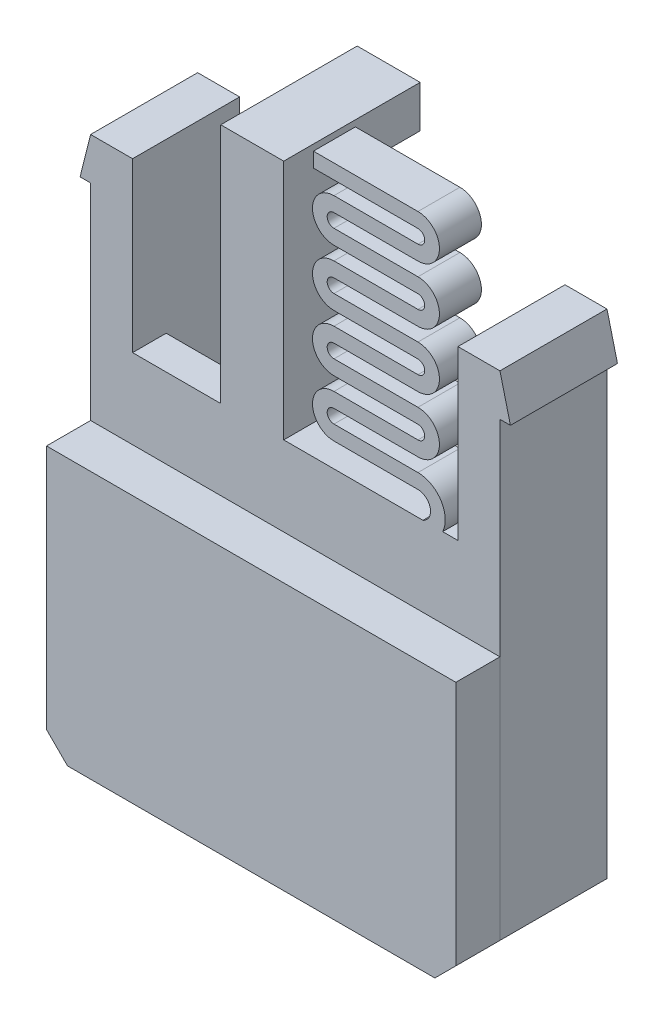
from build123d import *

# Parameters (mm, degrees)
SKETCH_1_W           = 19.5
SKETCH_1_H           = 12.7
EXTRUDE_1_DEPTH      = 2.1
SKETCH_2_W           = 19.5
SKETCH_2_H           = 24.5
EXTRUDE_2_DEPTH      = 5.1
SKETCH_3_W           = 15.5
SKETCH_3_H           = 3.5
CUT_EXTRUDE_1_DEPTH  = 23
CUT_EXTRUDE_2_REACH  = 67.984
SKETCH_4_W           = 15.5
SKETCH_4_H           = 8
EXTRUDE_4_DEPTH      = 5.1
EXTRUDE_5_DEPTH      = 2
EXTRUDE_6_DEPTH      = 11.5
EXTRUDE_6_DEPTH_BACK = 4
SKETCH_8_W           = 3
SKETCH_8_H           = 3
SKETCH_9_W           = 3
SKETCH_9_H           = 2
EXTRUDE_7_DEPTH      = 3.5
CHAMFER_1_SIZE       = 1


# Read off the part's stored shape, not the designer's step: 分割1
with BuildPart() as part:
    # 草图1 → 凸台-拉伸1 (new body)
    with BuildSketch(Plane.XY):
        with Locations((-53.015330564, -13.356843897)):
            Rectangle(SKETCH_1_W, SKETCH_1_H)
    extrude(amount=EXTRUDE_1_DEPTH)

    # 草图2 → 凸台-拉伸2 (add)
    with BuildSketch(Plane(origin=(0, 0, 0), x_dir=(-1, 0, 0), z_dir=(0, 0, -1))):
        with Locations((53.015330564, -7.456843897)):
            Rectangle(SKETCH_2_W, SKETCH_2_H)
    extrude(amount=EXTRUDE_2_DEPTH)

    # 草图3 → 切除-拉伸1 (cut)
    with BuildSketch(Plane(origin=(0, 4.793156103, 0), x_dir=(1, 0, 0), z_dir=(0, 1, 0))):
        with Locations((-53.015330564, 3.35)):
            Rectangle(SKETCH_3_W, SKETCH_3_H)
    extrude(amount=-CUT_EXTRUDE_1_DEPTH, mode=Mode.SUBTRACT)

    # 草图4 → 切除-拉伸2 (cut, up to next)
    with BuildSketch(Plane.XY, mode=Mode.PRIVATE) as cut_extrude_2_sk1:
        with Locations((-53.015330564, 0.793156103)):
            Rectangle(SKETCH_4_W, SKETCH_4_H)
    cut_extrude_2_tool1 = extrude(cut_extrude_2_sk1.sketch, amount=-CUT_EXTRUDE_2_REACH, mode=Mode.PRIVATE) & part.part
    add(cut_extrude_2_tool1.solids().sort_by_distance((-53.015331, 0.793156, 0))[0], mode=Mode.SUBTRACT)

    # 草图5 → 凸台-拉伸4 (add)
    with BuildSketch(Plane(origin=(0, 0, -5.1), x_dir=(-1, 0, 0), z_dir=(0, 0, -1))):
        Polygon((62.765330564, 4.793156103), (63.265330564, 2.793156103), (62.765330564, 2.793156103), align=None)
        Polygon((43.265330564, 4.793156103), (42.765330564, 2.793156103), (43.265330564, 2.793156103), align=None)
    extrude(amount=-EXTRUDE_4_DEPTH)

    # 草图7 → 凸台-拉伸5 (add)
    with BuildSketch(Plane.XY):
        with BuildLine():
            Line((-47.171144023, -1.356843897), (-51.171144023, -1.356843897))
            ThreePointArc((-51.171144023, -1.356843897), (-51.494269023, -1.033718897), (-51.171144023, -0.710593897))
            Line((-51.171144023, -0.710593897), (-47.171144023, -0.710593897))
            ThreePointArc((-47.171144023, -0.710593897), (-46.148019023, 0.312531103), (-47.171144023, 1.335656103))
            Line((-47.171144023, 1.335656103), (-51.171144023, 1.335656103))
            ThreePointArc((-51.171144023, 1.335656103), (-51.494269023, 1.658781103), (-51.171144023, 1.981906103))
            Line((-51.171144023, 1.981906103), (-47.171144023, 1.981906103))
            ThreePointArc((-47.171144023, 1.981906103), (-46.148019023, 3.005031103), (-47.171144023, 4.028156103))
            Line((-47.171144023, 4.028156103), (-51.171144023, 4.028156103))
            ThreePointArc((-51.171144023, 4.028156103), (-51.494269023, 4.351281103), (-51.171144023, 4.674406103))
            Line((-51.171144023, 4.674406103), (-47.171144023, 4.674406103))
            ThreePointArc((-47.171144023, 4.674406103), (-46.148019023, 5.697531103), (-47.171144023, 6.720656103))
            Line((-47.171144023, 6.720656103), (-51.171144023, 6.720656103))
            ThreePointArc((-51.171144023, 6.720656103), (-51.494269023, 7.043781103), (-51.171144023, 7.366906103))
            Line((-51.171144023, 7.366906103), (-47.171144023, 7.366906103))
            ThreePointArc((-47.171144023, 7.366906103), (-46.148019023, 8.390031103), (-47.171144023, 9.413156103))
            Line((-47.171144023, 9.413156103), (-52.150877486, 9.413156103))
            Line((-52.150877486, 9.413156103), (-52.150877486, 8.713156103))
            Line((-52.150877486, 8.713156103), (-47.171144023, 8.713156103))
            ThreePointArc((-47.171144023, 8.713156103), (-46.848019023, 8.390031103), (-47.171144023, 8.066906103))
            Line((-47.171144023, 8.066906103), (-51.171144023, 8.066906103))
            ThreePointArc((-51.171144023, 8.066906103), (-52.194269023, 7.043781103), (-51.171144023, 6.020656103))
            Line((-51.171144023, 6.020656103), (-47.171144023, 6.020656103))
            ThreePointArc((-47.171144023, 6.020656103), (-46.848019023, 5.697531103), (-47.171144023, 5.374406103))
            Line((-47.171144023, 5.374406103), (-51.171144023, 5.374406103))
            ThreePointArc((-51.171144023, 5.374406103), (-52.194269023, 4.351281103), (-51.171144023, 3.328156103))
            Line((-51.171144023, 3.328156103), (-47.171144023, 3.328156103))
            ThreePointArc((-47.171144023, 3.328156103), (-46.848019023, 3.005031103), (-47.171144023, 2.681906103))
            Line((-47.171144023, 2.681906103), (-51.171144023, 2.681906103))
            ThreePointArc((-51.171144023, 2.681906103), (-52.194269023, 1.658781103), (-51.171144023, 0.635656103))
            Line((-51.171144023, 0.635656103), (-47.171144023, 0.635656103))
            ThreePointArc((-47.171144023, 0.635656103), (-46.848019023, 0.312531103), (-47.171144023, -0.010593897))
            Line((-47.171144023, -0.010593897), (-51.171144023, -0.010593897))
            ThreePointArc((-51.171144023, -0.010593897), (-52.194269023, -1.033718897), (-51.171144023, -2.056843897))
            Line((-51.171144023, -2.056843897), (-47.171144023, -2.056843897))
            ThreePointArc((-47.171144023, -2.056843897), (-46.583777016, -2.53436941), (-46.931352446, -3.206843897))
            Line((-46.931352446, -3.206843897), (-47.396871104, -3.937096718))
            ThreePointArc((-47.396871104, -3.937096718), (-45.876090227, -2.770138498), (-47.171144023, -1.356843897))
        make_face()
    extrude(amount=-EXTRUDE_5_DEPTH)

    # 草图8 → 凸台-拉伸6 (add, two sides: drawn at the far end of the back side and taken through both)
    with BuildSketch(Plane(origin=(0, -3.206843897, 0), x_dir=(1, 0, 0), z_dir=(0, 1, 0)).offset(-EXTRUDE_6_DEPTH_BACK)):
        with Locations((-55.065330564, 1.5)):
            Rectangle(SKETCH_8_W, SKETCH_8_H)
    extrude(amount=EXTRUDE_6_DEPTH + EXTRUDE_6_DEPTH_BACK)

    # 草图9 → 凸台-拉伸7 (add)
    with BuildSketch(Plane(origin=(0, 0, -3), x_dir=(-1, 0, 0), z_dir=(0, 0, -1))):
        with Locations((55.065330564, 7.293156103)):
            Rectangle(SKETCH_9_W, SKETCH_9_H)
    extrude(amount=EXTRUDE_7_DEPTH)

    # 倒角1
    chamfer_1_edges = [part.edges().sort_by_distance(p)[0] for p in [
        (-43.265330564, -19.706843897, -1.5),
        (-62.765330564, -19.706843897, -1.5),
    ]]
    chamfer(chamfer_1_edges, length=CHAMFER_1_SIZE)


with BuildPart() as body_2:
    # Split Bodies 1: the piece on the far side of the plane
    add(part.part)
    split(bisect_by=Plane.XY, keep=Keep.BOTTOM)


with BuildPart() as part_1:
    add(part.part)

    # Split Bodies 1
    split(bisect_by=Plane.XY, keep=Keep.TOP)


solid = Compound([body_2.part, part_1.part])
